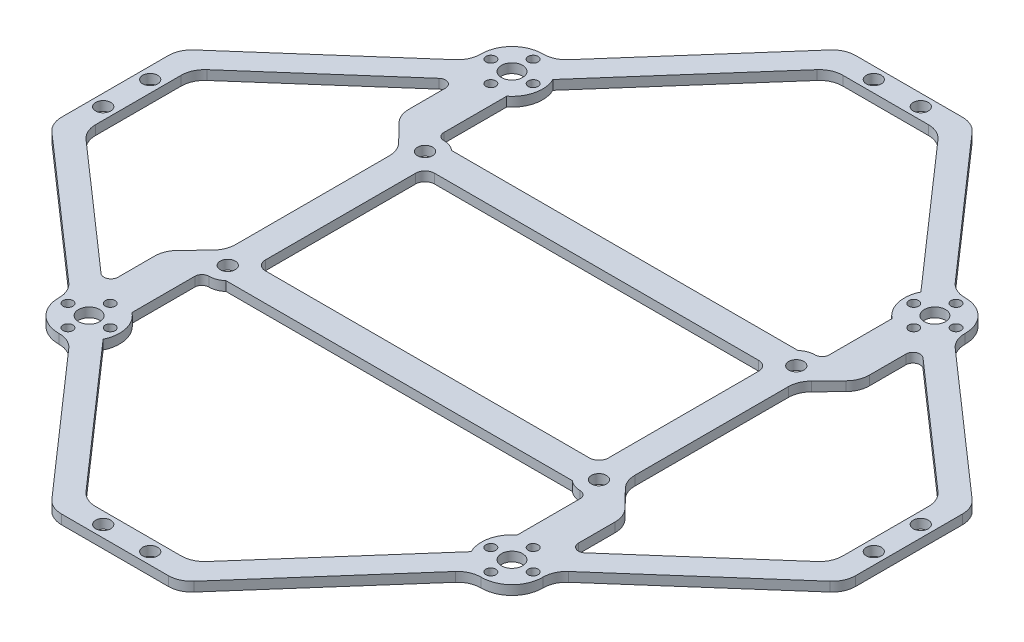
from build123d import *

# Parameters (mm, degrees)
SKETCH_1_R      = 1.6
SKETCH_1_R_2    = 2.25
SKETCH_1_R_3    = 1.05
EXTRUDE_2_DEPTH = 2


with BuildPart() as part:
    # 草图1 → 凸台-拉伸2 (new body)
    with BuildSketch(Plane(origin=(0, 0, 0), x_dir=(1, 0, 0), z_dir=(0, 1, 0))):
        with BuildLine():
            Line((-41.125061415, 53.199686028), (-15.125044792, 82.799704953))
            ThreePointArc((-15.125044792, 82.799704953), (-13.430189318, 84.055135825), (-11.368457614, 84.5))
            Line((-11.368457614, 84.5), (11.368457614, 84.5))
            ThreePointArc((11.368457614, 84.5), (13.430189318, 84.055135825), (15.125044792, 82.799704953))
            Line((15.125044792, 82.799704953), (41.125061415, 53.199686028))
            ThreePointArc((41.125061415, 53.199686028), (42.843383919, 51.933706244), (44.933105726, 51.499655772))
            ThreePointArc((44.933105726, 51.499655772), (49.596194078, 49.596194078), (51.499655772, 44.933105726))
            ThreePointArc((51.499655772, 44.933105726), (51.933706244, 42.843383919), (53.199686028, 41.125061415))
            Line((53.199686028, 41.125061415), (82.799704953, 15.125044792))
            ThreePointArc((82.799704953, 15.125044792), (84.055135825, 13.430189318), (84.5, 11.368457614))
            Line((84.5, 11.368457614), (84.5, -11.368457614))
            ThreePointArc((84.5, -11.368457614), (84.055135825, -13.430189318), (82.799704953, -15.125044792))
            Line((82.799704953, -15.125044792), (53.199686028, -41.125061415))
            ThreePointArc((53.199686028, -41.125061415), (51.933706244, -42.843383919), (51.499655772, -44.933105726))
            ThreePointArc((51.499655772, -44.933105726), (49.596194078, -49.596194078), (44.933105726, -51.499655772))
            ThreePointArc((44.933105726, -51.499655772), (42.843383919, -51.933706244), (41.125061415, -53.199686028))
            Line((41.125061415, -53.199686028), (15.125044792, -82.799704953))
            ThreePointArc((15.125044792, -82.799704953), (13.430189318, -84.055135825), (11.368457614, -84.5))
            Line((11.368457614, -84.5), (-11.368457614, -84.5))
            ThreePointArc((-11.368457614, -84.5), (-13.430189318, -84.055135825), (-15.125044792, -82.799704953))
            Line((-15.125044792, -82.799704953), (-41.125061415, -53.199686028))
            ThreePointArc((-41.125061415, -53.199686028), (-42.843383919, -51.933706244), (-44.933105726, -51.499655772))
            ThreePointArc((-44.933105726, -51.499655772), (-49.596194078, -49.596194078), (-51.499655772, -44.933105726))
            ThreePointArc((-51.499655772, -44.933105726), (-51.933706244, -42.843383919), (-53.199686028, -41.125061415))
            Line((-53.199686028, -41.125061415), (-82.799704953, -15.125044792))
            ThreePointArc((-82.799704953, -15.125044792), (-84.055135825, -13.430189318), (-84.5, -11.368457614))
            Line((-84.5, -11.368457614), (-84.5, 11.368457614))
            ThreePointArc((-84.5, 11.368457614), (-84.055135825, 13.430189318), (-82.799704953, 15.125044792))
            Line((-82.799704953, 15.125044792), (-53.199686028, 41.125061415))
            ThreePointArc((-53.199686028, 41.125061415), (-51.933706244, 42.843383919), (-51.499655772, 44.933105726))
            ThreePointArc((-51.499655772, 44.933105726), (-49.596194078, 49.596194078), (-44.933105726, 51.499655772))
            ThreePointArc((-44.933105726, 51.499655772), (-42.843383919, 51.933706244), (-41.125061415, 53.199686028))
        make_face()
        with Locations((-39.5, 21)):
            Circle(SKETCH_1_R, mode=Mode.SUBTRACT)
        with Locations((39.5, 21)):
            Circle(SKETCH_1_R, mode=Mode.SUBTRACT)
        with Locations((39.5, -21)):
            Circle(SKETCH_1_R, mode=Mode.SUBTRACT)
        with Locations((-39.5, -21)):
            Circle(SKETCH_1_R, mode=Mode.SUBTRACT)
        with Locations((45, 45)):
            Circle(SKETCH_1_R_2, mode=Mode.SUBTRACT)
        with Locations((45, 49.5)):
            Circle(SKETCH_1_R_3, mode=Mode.SUBTRACT)
        with Locations((49.5, 45)):
            Circle(SKETCH_1_R_3, mode=Mode.SUBTRACT)
        with Locations((45, 40.5)):
            Circle(SKETCH_1_R_3, mode=Mode.SUBTRACT)
        with Locations((40.5, 45)):
            Circle(SKETCH_1_R_3, mode=Mode.SUBTRACT)
        with Locations((40.5, -45)):
            Circle(SKETCH_1_R_3, mode=Mode.SUBTRACT)
        with Locations((45, -40.5)):
            Circle(SKETCH_1_R_3, mode=Mode.SUBTRACT)
        with Locations((49.5, -45)):
            Circle(SKETCH_1_R_3, mode=Mode.SUBTRACT)
        with Locations((45, -49.5)):
            Circle(SKETCH_1_R_3, mode=Mode.SUBTRACT)
        with Locations((45, -45)):
            Circle(SKETCH_1_R_2, mode=Mode.SUBTRACT)
        with Locations((-45, -40.5)):
            Circle(SKETCH_1_R_3, mode=Mode.SUBTRACT)
        with Locations((-40.5, -45)):
            Circle(SKETCH_1_R_3, mode=Mode.SUBTRACT)
        with Locations((-45, -49.5)):
            Circle(SKETCH_1_R_3, mode=Mode.SUBTRACT)
        with Locations((-49.5, -45)):
            Circle(SKETCH_1_R_3, mode=Mode.SUBTRACT)
        with Locations((-45, -45)):
            Circle(SKETCH_1_R_2, mode=Mode.SUBTRACT)
        with Locations((-40.5, 45)):
            Circle(SKETCH_1_R_3, mode=Mode.SUBTRACT)
        with Locations((-45, 40.5)):
            Circle(SKETCH_1_R_3, mode=Mode.SUBTRACT)
        with Locations((-49.5, 45)):
            Circle(SKETCH_1_R_3, mode=Mode.SUBTRACT)
        with Locations((-45, 49.5)):
            Circle(SKETCH_1_R_3, mode=Mode.SUBTRACT)
        with Locations((-45, 45)):
            Circle(SKETCH_1_R_2, mode=Mode.SUBTRACT)
        with Locations((5, 82)):
            Circle(SKETCH_1_R, mode=Mode.SUBTRACT)
        with Locations((-5, 82)):
            Circle(SKETCH_1_R, mode=Mode.SUBTRACT)
        with Locations((82, 5)):
            Circle(SKETCH_1_R, mode=Mode.SUBTRACT)
        with Locations((82, -5)):
            Circle(SKETCH_1_R, mode=Mode.SUBTRACT)
        with Locations((5, -82)):
            Circle(SKETCH_1_R, mode=Mode.SUBTRACT)
        with Locations((-5, -82)):
            Circle(SKETCH_1_R, mode=Mode.SUBTRACT)
        with Locations((-82, -5)):
            Circle(SKETCH_1_R, mode=Mode.SUBTRACT)
        with Locations((-82, 5)):
            Circle(SKETCH_1_R, mode=Mode.SUBTRACT)
        with BuildLine():
            Line((41, 39.876524617), (41, 26.5))
            ThreePointArc((41, 26.5), (40.560660172, 25.439339828), (39.5, 25))
            ThreePointArc((39.5, 25), (38.085786438, 24.741657387), (36.854248689, 24))
            Line((36.854248689, 24), (-36.854248689, 24))
            ThreePointArc((-36.854248689, 24), (-38.085786438, 24.741657387), (-39.5, 25))
            ThreePointArc((-39.5, 25), (-40.560660172, 25.439339828), (-41, 26.5))
            Line((-41, 26.5), (-41, 39.876524617))
            ThreePointArc((-41, 39.876524617), (-38.665770848, 43.541390713), (-39.162060467, 47.858052136))
            Line((-39.162060467, 47.858052136), (-12.86196002, 77.799704953))
            ThreePointArc((-12.86196002, 77.799704953), (-11.167104546, 79.055135825), (-9.105372843, 79.5))
            Line((-9.105372843, 79.5), (9.105372843, 79.5))
            ThreePointArc((9.105372843, 79.5), (11.167104546, 79.055135825), (12.86196002, 77.799704953))
            Line((12.86196002, 77.799704953), (39.162060467, 47.858052136))
            ThreePointArc((39.162060467, 47.858052136), (38.665770848, 43.541390713), (41, 39.876524617))
        make_face(mode=Mode.SUBTRACT)
        with BuildLine():
            Line((43.923529412, 19.803881957), (47.576470588, 23.54291939))
            ThreePointArc((47.576470588, 23.54291939), (48.630461799, 25.1505526), (49, 27.037037037))
            Line((49, 27.037037037), (49, 34.844937588))
            ThreePointArc((49, 34.844937588), (49.881480489, 36.211478336), (51.489911486, 35.971913741))
            Line((51.489911486, 35.971913741), (77.799704953, 12.86196002))
            ThreePointArc((77.799704953, 12.86196002), (79.055135825, 11.167104546), (79.5, 9.105372843))
            Line((79.5, 9.105372843), (79.5, -9.105372843))
            ThreePointArc((79.5, -9.105372843), (79.055135825, -11.167104546), (77.799704953, -12.86196002))
            Line((77.799704953, -12.86196002), (51.489911486, -35.971913741))
            ThreePointArc((51.489911486, -35.971913741), (49.881480489, -36.211478336), (49, -34.844937588))
            Line((49, -34.844937588), (49, -27.037037037))
            ThreePointArc((49, -27.037037037), (48.630461799, -25.1505526), (47.576470588, -23.54291939))
            Line((47.576470588, -23.54291939), (43.923529412, -19.803881957))
            ThreePointArc((43.923529412, -19.803881957), (42.869538201, -18.196248746), (42.5, -16.30976431))
            Line((42.5, -16.30976431), (42.5, 16.30976431))
            ThreePointArc((42.5, 16.30976431), (42.869538201, 18.196248746), (43.923529412, 19.803881957))
        make_face(mode=Mode.SUBTRACT)
        with BuildLine():
            Line((41, -26.5), (41, -39.876524617))
            ThreePointArc((41, -39.876524617), (38.665770848, -43.541390713), (39.162060467, -47.858052136))
            Line((39.162060467, -47.858052136), (12.86196002, -77.799704953))
            ThreePointArc((12.86196002, -77.799704953), (11.167104546, -79.055135825), (9.105372843, -79.5))
            Line((9.105372843, -79.5), (-9.105372843, -79.5))
            ThreePointArc((-9.105372843, -79.5), (-11.167104546, -79.055135825), (-12.86196002, -77.799704953))
            Line((-12.86196002, -77.799704953), (-39.162060467, -47.858052136))
            ThreePointArc((-39.162060467, -47.858052136), (-38.665770848, -43.541390713), (-41, -39.876524617))
            Line((-41, -39.876524617), (-41, -26.5))
            ThreePointArc((-41, -26.5), (-40.560660172, -25.439339828), (-39.5, -25))
            ThreePointArc((-39.5, -25), (-38.085786438, -24.741657387), (-36.854248689, -24))
            Line((-36.854248689, -24), (36.854248689, -24))
            ThreePointArc((36.854248689, -24), (38.085786438, -24.741657387), (39.5, -25))
            ThreePointArc((39.5, -25), (40.560660172, -25.439339828), (41, -26.5))
        make_face(mode=Mode.SUBTRACT)
        with BuildLine():
            Line((-49, -34.844937588), (-49, -27.037037037))
            ThreePointArc((-49, -27.037037037), (-48.630461799, -25.1505526), (-47.576470588, -23.54291939))
            Line((-47.576470588, -23.54291939), (-43.923529412, -19.803881957))
            ThreePointArc((-43.923529412, -19.803881957), (-42.869538201, -18.196248746), (-42.5, -16.30976431))
            Line((-42.5, -16.30976431), (-42.5, 16.30976431))
            ThreePointArc((-42.5, 16.30976431), (-42.869538201, 18.196248746), (-43.923529412, 19.803881957))
            Line((-43.923529412, 19.803881957), (-47.576470588, 23.54291939))
            ThreePointArc((-47.576470588, 23.54291939), (-48.630461799, 25.1505526), (-49, 27.037037037))
            Line((-49, 27.037037037), (-49, 34.844937588))
            ThreePointArc((-49, 34.844937588), (-49.881480489, 36.211478336), (-51.489911486, 35.971913741))
            Line((-51.489911486, 35.971913741), (-77.799704953, 12.86196002))
            ThreePointArc((-77.799704953, 12.86196002), (-79.055135825, 11.167104546), (-79.5, 9.105372843))
            Line((-79.5, 9.105372843), (-79.5, -9.105372843))
            ThreePointArc((-79.5, -9.105372843), (-79.055135825, -11.167104546), (-77.799704953, -12.86196002))
            Line((-77.799704953, -12.86196002), (-51.489911486, -35.971913741))
            ThreePointArc((-51.489911486, -35.971913741), (-49.881480489, -36.211478336), (-49, -34.844937588))
        make_face(mode=Mode.SUBTRACT)
        with BuildLine():
            Line((-34.5, -18), (34.5, -18))
            ThreePointArc((34.5, -18), (35.914213562, -17.414213562), (36.5, -16))
            Line((36.5, -16), (36.5, 16))
            ThreePointArc((36.5, 16), (35.914213562, 17.414213562), (34.5, 18))
            Line((34.5, 18), (-34.5, 18))
            ThreePointArc((-34.5, 18), (-35.914213562, 17.414213562), (-36.5, 16))
            Line((-36.5, 16), (-36.5, -16))
            ThreePointArc((-36.5, -16), (-35.914213562, -17.414213562), (-34.5, -18))
        make_face(mode=Mode.SUBTRACT)
    extrude(amount=EXTRUDE_2_DEPTH)


solid = part.part
